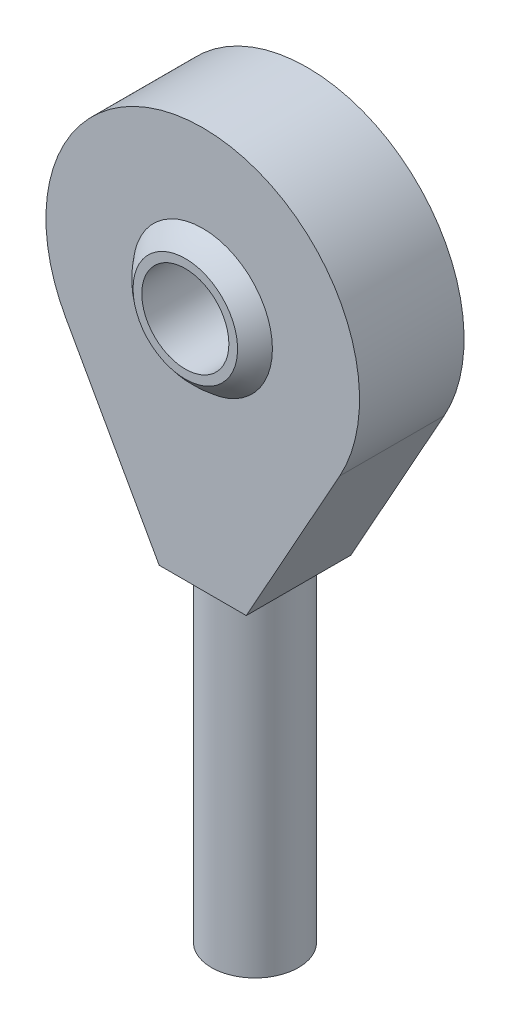
from build123d import *

# Parameters (mm, degrees)
SKETCH2_R           = 2.5
BOSS_EXTRUDE1_DEPTH = 19
BOSS_EXTRUDE2_DEPTH = 3
SKETCH7_W           = 10
SKETCH7_H           = 20
CUT_EXTRUDE2_DEPTH  = 5
SKETCH4_R           = 2.5
CUT_EXTRUDE1_DEPTH  = 44.69210455


# Read off the part's stored shape, not the designer's step: Sweep1
with BuildPart() as part:
    # Sketch2 → Boss-Extrude1 (new body)
    with BuildSketch(Plane(origin=(0, 0, 0), x_dir=(1, 0, 0), z_dir=(0, 1, 0))):
        with Locations(Location((0, 0, 0), (0, 0, 270))):
            Circle(SKETCH2_R)
    extrude(amount=BOSS_EXTRUDE1_DEPTH)


with BuildPart() as body_2:
    # Sketch3 → Boss-Extrude2 (new, symmetric)
    with BuildSketch(Plane.XY):
        with BuildLine():
            Line((-2.5, 19), (-7.861216709, 28.618074412))
            ThreePointArc((-7.861216709, 28.618074412), (0, 42), (7.861216709, 28.618074412))
            Line((7.861216709, 28.618074412), (2.5, 19))
            Line((2.5, 19), (-2.5, 19))
        make_face()
    extrude(amount=BOSS_EXTRUDE2_DEPTH, both=True)

    # Sweep1 outline → Sweep1 (revolve)
    with BuildSketch(Plane.XZ.offset(-33)):
        with BuildLine():
            Line((0, -2.999999996), (0, -5))
            ThreePointArc((0, -5), (2.23606798, -4.472135954), (4.000000003, -2.999999996))
            Line((4.000000003, -2.999999996), (0, -2.999999996))
        make_face()
        with BuildLine():
            Line((0, 2.999999996), (4.000000003, 2.999999996))
            ThreePointArc((4.000000003, 2.999999996), (2.23606798, 4.472135954), (0, 5))
            Line((0, 5), (0, 2.999999996))
        make_face()
    revolve(axis=Axis((0, 33, 0), (0, 0, 1)))

    # Sketch7 → Cut-Extrude2 (cut, symmetric)
    with BuildSketch(Plane(origin=(0, 0, 0), x_dir=(0, 0, -1), z_dir=(1, 0, 0))):
        with Locations((9, 33)):
            Rectangle(SKETCH7_W, SKETCH7_H)
        with Locations((-9, 33)):
            Rectangle(SKETCH7_W, SKETCH7_H)
    extrude(amount=CUT_EXTRUDE2_DEPTH, both=True, mode=Mode.SUBTRACT)

    # Sketch4 → Cut-Extrude1 (cut, through all)
    with BuildSketch(Plane.XY.offset(4)):
        with Locations((0, 33)):
            Circle(SKETCH4_R)
    extrude(amount=-CUT_EXTRUDE1_DEPTH, mode=Mode.SUBTRACT)


solid = Compound([part.part, body_2.part])
